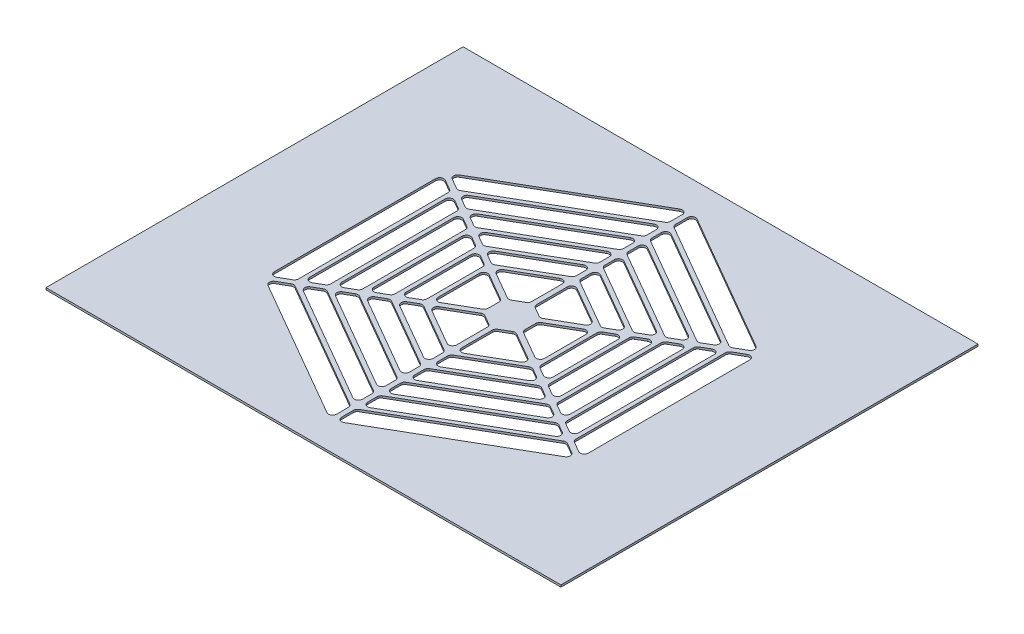
from build123d import *

# Parameters (mm, degrees)
SKETCH_1_W             = 252.630757478
SKETCH_1_H             = 204.6405437
SM_BASE_FLANGE_1_DEPTH = 1
MACRO_START            = -1
MACRO_FEATURE_3_DEPTH  = 1


# Read off the part's stored shape, not the designer's step: 通风口3
# Sheet-metal steps are written as plain solids
with BuildPart() as part:
    # Sketch 1 → 基体-法兰1 (new body)
    with BuildSketch(Plane(origin=(0, 0, 0), x_dir=(1, 0, 0), z_dir=(0, 1, 0))):
        Rectangle(SKETCH_1_W, SKETCH_1_H)
    extrude(amount=-SM_BASE_FLANGE_1_DEPTH)

    # Macro Feature 3 outline → Macro Feature 3 (cut)
    with BuildSketch(Plane(origin=(0, 0, 0), x_dir=(1, 0, 0), z_dir=(0, 1, 0)).offset(MACRO_START)):
        with BuildLine():
            Line((-74.051402444, -41.310221462), (-69.051402444, -38.423470116))
            ThreePointArc((-69.051402444, -38.423470116), (-68.319351637, -37.691419308), (-68.051402444, -36.691419308))
            Line((-68.051402444, -36.691419308), (-68.051402444, 36.691419308))
            ThreePointArc((-68.051402444, 36.691419308), (-68.319351637, 37.691419308), (-69.051402444, 38.423470116))
            Line((-69.051402444, 38.423470116), (-74.051402444, 41.310221462))
            ThreePointArc((-74.051402444, 41.310221462), (-76.051402444, 41.310221462), (-77.051402444, 39.578170654))
            Line((-77.051402444, 39.578170654), (-77.051402444, -39.578170654))
            ThreePointArc((-77.051402444, -39.578170654), (-76.051402444, -41.310221462), (-74.051402444, -41.310221462))
        make_face()
        with BuildLine():
            Line((67.801402444, 40.588533626), (72.801402444, 43.475284971))
            ThreePointArc((72.801402444, 43.475284971), (73.801402444, 45.207335779), (72.801402444, 46.939386587))
            Line((72.801402444, 46.939386587), (4.25, 86.517557241))
            ThreePointArc((4.25, 86.517557241), (2.25, 86.517557241), (1.25, 84.785506433))
            Line((1.25, 84.785506433), (1.25, 79.012003742))
            ThreePointArc((1.25, 79.012003742), (1.517949192, 78.012003742), (2.25, 77.279952934))
            Line((2.25, 77.279952934), (65.801402444, 40.588533626))
            ThreePointArc((65.801402444, 40.588533626), (66.801402444, 40.320584433), (67.801402444, 40.588533626))
        make_face()
        with BuildLine():
            Line((27.801402444, 17.494522858), (31.801402444, 19.803923935))
            ThreePointArc((31.801402444, 19.803923935), (32.801402444, 21.535974742), (31.801402444, 23.26802555))
            Line((31.801402444, 23.26802555), (4.25, 39.174835167))
            ThreePointArc((4.25, 39.174835167), (2.25, 39.174835167), (1.25, 37.44278436))
            Line((1.25, 37.44278436), (1.25, 32.823982206))
            ThreePointArc((1.25, 32.823982206), (1.517949192, 31.823982206), (2.25, 31.091931399))
            Line((2.25, 31.091931399), (25.801402444, 17.494522858))
            ThreePointArc((25.801402444, 17.494522858), (26.801402444, 17.226573665), (27.801402444, 17.494522858))
        make_face()
        with BuildLine():
            Line((-33.051402444, -17.638860425), (-29.051402444, -15.329459348))
            ThreePointArc((-29.051402444, -15.329459348), (-28.319351637, -14.597408541), (-28.051402444, -13.597408541))
            Line((-28.051402444, -13.597408541), (-28.051402444, 13.597408541))
            ThreePointArc((-28.051402444, 13.597408541), (-28.319351637, 14.597408541), (-29.051402444, 15.329459348))
            Line((-29.051402444, 15.329459348), (-33.051402444, 17.638860425))
            ThreePointArc((-33.051402444, 17.638860425), (-35.051402444, 17.638860425), (-36.051402444, 15.906809618))
            Line((-36.051402444, 15.906809618), (-36.051402444, -15.906809618))
            ThreePointArc((-36.051402444, -15.906809618), (-35.051402444, -17.638860425), (-33.051402444, -17.638860425))
        make_face()
        with BuildLine():
            Line((37.801402444, 23.26802555), (41.801402444, 25.577426627))
            ThreePointArc((41.801402444, 25.577426627), (42.801402444, 27.309477434), (41.801402444, 29.041528242))
            Line((41.801402444, 29.041528242), (4.25, 50.721840551))
            ThreePointArc((4.25, 50.721840551), (2.25, 50.721840551), (1.25, 48.989789744))
            Line((1.25, 48.989789744), (1.25, 44.37098759))
            ThreePointArc((1.25, 44.37098759), (1.517949192, 43.37098759), (2.25, 42.638936783))
            Line((2.25, 42.638936783), (35.801402444, 23.26802555))
            ThreePointArc((35.801402444, 23.26802555), (36.801402444, 23.000076357), (37.801402444, 23.26802555))
        make_face()
        with BuildLine():
            Line((-43.051402444, -23.412363117), (-39.051402444, -21.10296204))
            ThreePointArc((-39.051402444, -21.10296204), (-38.319351637, -20.370911233), (-38.051402444, -19.370911233))
            Line((-38.051402444, -19.370911233), (-38.051402444, 19.370911233))
            ThreePointArc((-38.051402444, 19.370911233), (-38.319351637, 20.370911233), (-39.051402444, 21.10296204))
            Line((-39.051402444, 21.10296204), (-43.051402444, 23.412363117))
            ThreePointArc((-43.051402444, 23.412363117), (-45.051402444, 23.412363117), (-46.051402444, 21.68031231))
            Line((-46.051402444, 21.68031231), (-46.051402444, -21.68031231))
            ThreePointArc((-46.051402444, -21.68031231), (-45.051402444, -23.412363117), (-43.051402444, -23.412363117))
        make_face()
        with BuildLine():
            Line((47.801402444, 29.041528242), (51.801402444, 31.350929318))
            ThreePointArc((51.801402444, 31.350929318), (52.801402444, 33.082980126), (51.801402444, 34.815030934))
            Line((51.801402444, 34.815030934), (4.25, 62.268845935))
            ThreePointArc((4.25, 62.268845935), (2.25, 62.268845935), (1.25, 60.536795127))
            Line((1.25, 60.536795127), (1.25, 55.917992974))
            ThreePointArc((1.25, 55.917992974), (1.517949192, 54.917992974), (2.25, 54.185942166))
            Line((2.25, 54.185942166), (45.801402444, 29.041528242))
            ThreePointArc((45.801402444, 29.041528242), (46.801402444, 28.773579049), (47.801402444, 29.041528242))
        make_face()
        with BuildLine():
            Line((57.801402444, 34.815030934), (61.801402444, 37.12443201))
            ThreePointArc((61.801402444, 37.12443201), (62.801402444, 38.856482818), (61.801402444, 40.588533626))
            Line((61.801402444, 40.588533626), (4.25, 73.815851319))
            ThreePointArc((4.25, 73.815851319), (2.25, 73.815851319), (1.25, 72.083800511))
            Line((1.25, 72.083800511), (1.25, 67.464998358))
            ThreePointArc((1.25, 67.464998358), (1.517949192, 66.464998358), (2.25, 65.73294755))
            Line((2.25, 65.73294755), (55.801402444, 34.815030934))
            ThreePointArc((55.801402444, 34.815030934), (56.801402444, 34.547081741), (57.801402444, 34.815030934))
        make_face()
        with BuildLine():
            Line((-53.051402444, -29.185865809), (-49.051402444, -26.876464732))
            ThreePointArc((-49.051402444, -26.876464732), (-48.319351637, -26.144413925), (-48.051402444, -25.144413925))
            Line((-48.051402444, -25.144413925), (-48.051402444, 25.144413925))
            ThreePointArc((-48.051402444, 25.144413925), (-48.319351637, 26.144413925), (-49.051402444, 26.876464732))
            Line((-49.051402444, 26.876464732), (-53.051402444, 29.185865809))
            ThreePointArc((-53.051402444, 29.185865809), (-55.051402444, 29.185865809), (-56.051402444, 27.453815001))
            Line((-56.051402444, 27.453815001), (-56.051402444, -27.453815001))
            ThreePointArc((-56.051402444, -27.453815001), (-55.051402444, -29.185865809), (-53.051402444, -29.185865809))
        make_face()
        with BuildLine():
            Line((-63.051402444, -34.959368501), (-59.051402444, -32.649967424))
            ThreePointArc((-59.051402444, -32.649967424), (-58.319351637, -31.917916617), (-58.051402444, -30.917916617))
            Line((-58.051402444, -30.917916617), (-58.051402444, 30.917916617))
            ThreePointArc((-58.051402444, 30.917916617), (-58.319351637, 31.917916617), (-59.051402444, 32.649967424))
            Line((-59.051402444, 32.649967424), (-63.051402444, 34.959368501))
            ThreePointArc((-63.051402444, 34.959368501), (-65.051402444, 34.959368501), (-66.051402444, 33.227317693))
            Line((-66.051402444, 33.227317693), (-66.051402444, -33.227317693))
            ThreePointArc((-66.051402444, -33.227317693), (-65.051402444, -34.959368501), (-63.051402444, -34.959368501))
        make_face()
        with BuildLine():
            Line((8.801402444, 6.524867743), (21.801402444, 14.030421243))
            ThreePointArc((21.801402444, 14.030421243), (22.801402444, 15.76247205), (21.801402444, 17.494522858))
            Line((21.801402444, 17.494522858), (4.25, 27.627829784))
            ThreePointArc((4.25, 27.627829784), (2.25, 27.627829784), (1.25, 25.895778976))
            Line((1.25, 25.895778976), (1.25, 10.884671977))
            ThreePointArc((1.25, 10.884671977), (1.517949192, 9.884671977), (2.25, 9.15262117))
            Line((2.25, 9.15262117), (6.801402444, 6.524867743))
            ThreePointArc((6.801402444, 6.524867743), (7.801402444, 6.256918551), (8.801402444, 6.524867743))
        make_face()
        with BuildLine():
            Line((-23.051402444, -11.865357733), (-10.051402444, -4.359804234))
            ThreePointArc((-10.051402444, -4.359804234), (-9.319351637, -3.627753426), (-9.051402444, -2.627753426))
            Line((-9.051402444, -2.627753426), (-9.051402444, 2.627753426))
            ThreePointArc((-9.051402444, 2.627753426), (-9.319351637, 3.627753426), (-10.051402444, 4.359804234))
            Line((-10.051402444, 4.359804234), (-23.051402444, 11.865357733))
            ThreePointArc((-23.051402444, 11.865357733), (-25.051402444, 11.865357733), (-26.051402444, 10.133306926))
            Line((-26.051402444, 10.133306926), (-26.051402444, -10.133306926))
            ThreePointArc((-26.051402444, -10.133306926), (-25.051402444, -11.865357733), (-23.051402444, -11.865357733))
        make_face()
        with BuildLine():
            Line((72.801402444, -43.475284971), (67.801402444, -40.588533626))
            ThreePointArc((67.801402444, -40.588533626), (66.801402444, -40.320584433), (65.801402444, -40.588533626))
            Line((65.801402444, -40.588533626), (2.25, -77.279952934))
            ThreePointArc((2.25, -77.279952934), (1.517949192, -78.012003742), (1.25, -79.012003742))
            Line((1.25, -79.012003742), (1.25, -84.785506433))
            ThreePointArc((1.25, -84.785506433), (2.25, -86.517557241), (4.25, -86.517557241))
            Line((4.25, -86.517557241), (72.801402444, -46.939386587))
            ThreePointArc((72.801402444, -46.939386587), (73.801402444, -45.207335779), (72.801402444, -43.475284971))
        make_face()
        with BuildLine():
            Line((61.801402444, -37.12443201), (57.801402444, -34.815030934))
            ThreePointArc((57.801402444, -34.815030934), (56.801402444, -34.547081741), (55.801402444, -34.815030934))
            Line((55.801402444, -34.815030934), (2.25, -65.73294755))
            ThreePointArc((2.25, -65.73294755), (1.517949192, -66.464998358), (1.25, -67.464998358))
            Line((1.25, -67.464998358), (1.25, -72.083800511))
            ThreePointArc((1.25, -72.083800511), (2.25, -73.815851319), (4.25, -73.815851319))
            Line((4.25, -73.815851319), (61.801402444, -40.588533626))
            ThreePointArc((61.801402444, -40.588533626), (62.801402444, -38.856482818), (61.801402444, -37.12443201))
        make_face()
        with BuildLine():
            Line((51.801402444, -31.350929318), (47.801402444, -29.041528242))
            ThreePointArc((47.801402444, -29.041528242), (46.801402444, -28.773579049), (45.801402444, -29.041528242))
            Line((45.801402444, -29.041528242), (2.25, -54.185942166))
            ThreePointArc((2.25, -54.185942166), (1.517949192, -54.917992974), (1.25, -55.917992974))
            Line((1.25, -55.917992974), (1.25, -60.536795127))
            ThreePointArc((1.25, -60.536795127), (2.25, -62.268845935), (4.25, -62.268845935))
            Line((4.25, -62.268845935), (51.801402444, -34.815030934))
            ThreePointArc((51.801402444, -34.815030934), (52.801402444, -33.082980126), (51.801402444, -31.350929318))
        make_face()
        with BuildLine():
            Line((41.801402444, -25.577426627), (37.801402444, -23.26802555))
            ThreePointArc((37.801402444, -23.26802555), (36.801402444, -23.000076357), (35.801402444, -23.26802555))
            Line((35.801402444, -23.26802555), (2.25, -42.638936783))
            ThreePointArc((2.25, -42.638936783), (1.517949192, -43.37098759), (1.25, -44.37098759))
            Line((1.25, -44.37098759), (1.25, -48.989789744))
            ThreePointArc((1.25, -48.989789744), (2.25, -50.721840551), (4.25, -50.721840551))
            Line((4.25, -50.721840551), (41.801402444, -29.041528242))
            ThreePointArc((41.801402444, -29.041528242), (42.801402444, -27.309477434), (41.801402444, -25.577426627))
        make_face()
        with BuildLine():
            Line((31.801402444, -19.803923935), (27.801402444, -17.494522858))
            ThreePointArc((27.801402444, -17.494522858), (26.801402444, -17.226573665), (25.801402444, -17.494522858))
            Line((25.801402444, -17.494522858), (2.25, -31.091931399))
            ThreePointArc((2.25, -31.091931399), (1.517949192, -31.823982206), (1.25, -32.823982206))
            Line((1.25, -32.823982206), (1.25, -37.44278436))
            ThreePointArc((1.25, -37.44278436), (2.25, -39.174835167), (4.25, -39.174835167))
            Line((4.25, -39.174835167), (31.801402444, -23.26802555))
            ThreePointArc((31.801402444, -23.26802555), (32.801402444, -21.535974742), (31.801402444, -19.803923935))
        make_face()
        with BuildLine():
            Line((21.801402444, -14.030421243), (8.801402444, -6.524867743))
            ThreePointArc((8.801402444, -6.524867743), (7.801402444, -6.256918551), (6.801402444, -6.524867743))
            Line((6.801402444, -6.524867743), (2.25, -9.15262117))
            ThreePointArc((2.25, -9.15262117), (1.517949192, -9.884671977), (1.25, -10.884671977))
            Line((1.25, -10.884671977), (1.25, -25.895778976))
            ThreePointArc((1.25, -25.895778976), (2.25, -27.627829784), (4.25, -27.627829784))
            Line((4.25, -27.627829784), (21.801402444, -17.494522858))
            ThreePointArc((21.801402444, -17.494522858), (22.801402444, -15.76247205), (21.801402444, -14.030421243))
        make_face()
        with BuildLine():
            Line((-1.25, 79.012003742), (-1.25, 84.785506433))
            ThreePointArc((-1.25, 84.785506433), (-2.25, 86.517557241), (-4.25, 86.517557241))
            Line((-4.25, 86.517557241), (-72.801402444, 46.939386587))
            ThreePointArc((-72.801402444, 46.939386587), (-73.801402444, 45.207335779), (-72.801402444, 43.475284971))
            Line((-72.801402444, 43.475284971), (-67.801402444, 40.588533626))
            ThreePointArc((-67.801402444, 40.588533626), (-66.801402444, 40.320584433), (-65.801402444, 40.588533626))
            Line((-65.801402444, 40.588533626), (-2.25, 77.279952934))
            ThreePointArc((-2.25, 77.279952934), (-1.517949192, 78.012003742), (-1.25, 79.012003742))
        make_face()
        with BuildLine():
            Line((-1.25, -84.785506433), (-1.25, -79.012003742))
            ThreePointArc((-1.25, -79.012003742), (-1.517949192, -78.012003742), (-2.25, -77.279952934))
            Line((-2.25, -77.279952934), (-65.801402444, -40.588533626))
            ThreePointArc((-65.801402444, -40.588533626), (-66.801402444, -40.320584433), (-67.801402444, -40.588533626))
            Line((-67.801402444, -40.588533626), (-72.801402444, -43.475284971))
            ThreePointArc((-72.801402444, -43.475284971), (-73.801402444, -45.207335779), (-72.801402444, -46.939386587))
            Line((-72.801402444, -46.939386587), (-4.25, -86.517557241))
            ThreePointArc((-4.25, -86.517557241), (-2.25, -86.517557241), (-1.25, -84.785506433))
        make_face()
        with BuildLine():
            Line((-1.25, -72.083800511), (-1.25, -67.464998358))
            ThreePointArc((-1.25, -67.464998358), (-1.517949192, -66.464998358), (-2.25, -65.73294755))
            Line((-2.25, -65.73294755), (-55.801402444, -34.815030934))
            ThreePointArc((-55.801402444, -34.815030934), (-56.801402444, -34.547081741), (-57.801402444, -34.815030934))
            Line((-57.801402444, -34.815030934), (-61.801402444, -37.12443201))
            ThreePointArc((-61.801402444, -37.12443201), (-62.801402444, -38.856482818), (-61.801402444, -40.588533626))
            Line((-61.801402444, -40.588533626), (-4.25, -73.815851319))
            ThreePointArc((-4.25, -73.815851319), (-2.25, -73.815851319), (-1.25, -72.083800511))
        make_face()
        with BuildLine():
            Line((-1.25, -60.536795127), (-1.25, -55.917992974))
            ThreePointArc((-1.25, -55.917992974), (-1.517949192, -54.917992974), (-2.25, -54.185942166))
            Line((-2.25, -54.185942166), (-45.801402444, -29.041528242))
            ThreePointArc((-45.801402444, -29.041528242), (-46.801402444, -28.773579049), (-47.801402444, -29.041528242))
            Line((-47.801402444, -29.041528242), (-51.801402444, -31.350929318))
            ThreePointArc((-51.801402444, -31.350929318), (-52.801402444, -33.082980126), (-51.801402444, -34.815030934))
            Line((-51.801402444, -34.815030934), (-4.25, -62.268845935))
            ThreePointArc((-4.25, -62.268845935), (-2.25, -62.268845935), (-1.25, -60.536795127))
        make_face()
        with BuildLine():
            Line((-1.25, -48.989789744), (-1.25, -44.37098759))
            ThreePointArc((-1.25, -44.37098759), (-1.517949192, -43.37098759), (-2.25, -42.638936783))
            Line((-2.25, -42.638936783), (-35.801402444, -23.26802555))
            ThreePointArc((-35.801402444, -23.26802555), (-36.801402444, -23.000076357), (-37.801402444, -23.26802555))
            Line((-37.801402444, -23.26802555), (-41.801402444, -25.577426627))
            ThreePointArc((-41.801402444, -25.577426627), (-42.801402444, -27.309477434), (-41.801402444, -29.041528242))
            Line((-41.801402444, -29.041528242), (-4.25, -50.721840551))
            ThreePointArc((-4.25, -50.721840551), (-2.25, -50.721840551), (-1.25, -48.989789744))
        make_face()
        with BuildLine():
            Line((-1.25, -37.44278436), (-1.25, -32.823982206))
            ThreePointArc((-1.25, -32.823982206), (-1.517949192, -31.823982206), (-2.25, -31.091931399))
            Line((-2.25, -31.091931399), (-25.801402444, -17.494522858))
            ThreePointArc((-25.801402444, -17.494522858), (-26.801402444, -17.226573665), (-27.801402444, -17.494522858))
            Line((-27.801402444, -17.494522858), (-31.801402444, -19.803923935))
            ThreePointArc((-31.801402444, -19.803923935), (-32.801402444, -21.535974742), (-31.801402444, -23.26802555))
            Line((-31.801402444, -23.26802555), (-4.25, -39.174835167))
            ThreePointArc((-4.25, -39.174835167), (-2.25, -39.174835167), (-1.25, -37.44278436))
        make_face()
        with BuildLine():
            Line((-1.25, 32.823982206), (-1.25, 37.44278436))
            ThreePointArc((-1.25, 37.44278436), (-2.25, 39.174835167), (-4.25, 39.174835167))
            Line((-4.25, 39.174835167), (-31.801402444, 23.26802555))
            ThreePointArc((-31.801402444, 23.26802555), (-32.801402444, 21.535974742), (-31.801402444, 19.803923935))
            Line((-31.801402444, 19.803923935), (-27.801402444, 17.494522858))
            ThreePointArc((-27.801402444, 17.494522858), (-26.801402444, 17.226573665), (-25.801402444, 17.494522858))
            Line((-25.801402444, 17.494522858), (-2.25, 31.091931399))
            ThreePointArc((-2.25, 31.091931399), (-1.517949192, 31.823982206), (-1.25, 32.823982206))
        make_face()
        with BuildLine():
            Line((-1.25, 44.37098759), (-1.25, 48.989789744))
            ThreePointArc((-1.25, 48.989789744), (-2.25, 50.721840551), (-4.25, 50.721840551))
            Line((-4.25, 50.721840551), (-41.801402444, 29.041528242))
            ThreePointArc((-41.801402444, 29.041528242), (-42.801402444, 27.309477434), (-41.801402444, 25.577426627))
            Line((-41.801402444, 25.577426627), (-37.801402444, 23.26802555))
            ThreePointArc((-37.801402444, 23.26802555), (-36.801402444, 23.000076357), (-35.801402444, 23.26802555))
            Line((-35.801402444, 23.26802555), (-2.25, 42.638936783))
            ThreePointArc((-2.25, 42.638936783), (-1.517949192, 43.37098759), (-1.25, 44.37098759))
        make_face()
        with BuildLine():
            Line((-1.25, 55.917992974), (-1.25, 60.536795127))
            ThreePointArc((-1.25, 60.536795127), (-2.25, 62.268845935), (-4.25, 62.268845935))
            Line((-4.25, 62.268845935), (-51.801402444, 34.815030934))
            ThreePointArc((-51.801402444, 34.815030934), (-52.801402444, 33.082980126), (-51.801402444, 31.350929318))
            Line((-51.801402444, 31.350929318), (-47.801402444, 29.041528242))
            ThreePointArc((-47.801402444, 29.041528242), (-46.801402444, 28.773579049), (-45.801402444, 29.041528242))
            Line((-45.801402444, 29.041528242), (-2.25, 54.185942166))
            ThreePointArc((-2.25, 54.185942166), (-1.517949192, 54.917992974), (-1.25, 55.917992974))
        make_face()
        with BuildLine():
            Line((-1.25, 67.464998358), (-1.25, 72.083800511))
            ThreePointArc((-1.25, 72.083800511), (-2.25, 73.815851319), (-4.25, 73.815851319))
            Line((-4.25, 73.815851319), (-61.801402444, 40.588533626))
            ThreePointArc((-61.801402444, 40.588533626), (-62.801402444, 38.856482818), (-61.801402444, 37.12443201))
            Line((-61.801402444, 37.12443201), (-57.801402444, 34.815030934))
            ThreePointArc((-57.801402444, 34.815030934), (-56.801402444, 34.547081741), (-55.801402444, 34.815030934))
            Line((-55.801402444, 34.815030934), (-2.25, 65.73294755))
            ThreePointArc((-2.25, 65.73294755), (-1.517949192, 66.464998358), (-1.25, 67.464998358))
        make_face()
        with BuildLine():
            Line((-1.25, -25.895778976), (-1.25, -10.884671977))
            ThreePointArc((-1.25, -10.884671977), (-1.517949192, -9.884671977), (-2.25, -9.15262117))
            Line((-2.25, -9.15262117), (-6.801402444, -6.524867743))
            ThreePointArc((-6.801402444, -6.524867743), (-7.801402444, -6.256918551), (-8.801402444, -6.524867743))
            Line((-8.801402444, -6.524867743), (-21.801402444, -14.030421243))
            ThreePointArc((-21.801402444, -14.030421243), (-22.801402444, -15.76247205), (-21.801402444, -17.494522858))
            Line((-21.801402444, -17.494522858), (-4.25, -27.627829784))
            ThreePointArc((-4.25, -27.627829784), (-2.25, -27.627829784), (-1.25, -25.895778976))
        make_face()
        with BuildLine():
            Line((-1.25, 10.884671977), (-1.25, 25.895778976))
            ThreePointArc((-1.25, 25.895778976), (-2.25, 27.627829784), (-4.25, 27.627829784))
            Line((-4.25, 27.627829784), (-21.801402444, 17.494522858))
            ThreePointArc((-21.801402444, 17.494522858), (-22.801402444, 15.76247205), (-21.801402444, 14.030421243))
            Line((-21.801402444, 14.030421243), (-8.801402444, 6.524867743))
            ThreePointArc((-8.801402444, 6.524867743), (-7.801402444, 6.256918551), (-6.801402444, 6.524867743))
            Line((-6.801402444, 6.524867743), (-2.25, 9.15262117))
            ThreePointArc((-2.25, 9.15262117), (-1.517949192, 9.884671977), (-1.25, 10.884671977))
        make_face()
        with BuildLine():
            Line((69.051402444, -38.423470116), (74.051402444, -41.310221462))
            ThreePointArc((74.051402444, -41.310221462), (76.051402444, -41.310221462), (77.051402444, -39.578170654))
            Line((77.051402444, -39.578170654), (77.051402444, 39.578170654))
            ThreePointArc((77.051402444, 39.578170654), (76.051402444, 41.310221462), (74.051402444, 41.310221462))
            Line((74.051402444, 41.310221462), (69.051402444, 38.423470116))
            ThreePointArc((69.051402444, 38.423470116), (68.319351637, 37.691419308), (68.051402444, 36.691419308))
            Line((68.051402444, 36.691419308), (68.051402444, -36.691419308))
            ThreePointArc((68.051402444, -36.691419308), (68.319351637, -37.691419308), (69.051402444, -38.423470116))
        make_face()
        with BuildLine():
            Line((29.051402444, -15.329459348), (33.051402444, -17.638860425))
            ThreePointArc((33.051402444, -17.638860425), (35.051402444, -17.638860425), (36.051402444, -15.906809618))
            Line((36.051402444, -15.906809618), (36.051402444, 15.906809618))
            ThreePointArc((36.051402444, 15.906809618), (35.051402444, 17.638860425), (33.051402444, 17.638860425))
            Line((33.051402444, 17.638860425), (29.051402444, 15.329459348))
            ThreePointArc((29.051402444, 15.329459348), (28.319351637, 14.597408541), (28.051402444, 13.597408541))
            Line((28.051402444, 13.597408541), (28.051402444, -13.597408541))
            ThreePointArc((28.051402444, -13.597408541), (28.319351637, -14.597408541), (29.051402444, -15.329459348))
        make_face()
        with BuildLine():
            Line((39.051402444, -21.10296204), (43.051402444, -23.412363117))
            ThreePointArc((43.051402444, -23.412363117), (45.051402444, -23.412363117), (46.051402444, -21.68031231))
            Line((46.051402444, -21.68031231), (46.051402444, 21.68031231))
            ThreePointArc((46.051402444, 21.68031231), (45.051402444, 23.412363117), (43.051402444, 23.412363117))
            Line((43.051402444, 23.412363117), (39.051402444, 21.10296204))
            ThreePointArc((39.051402444, 21.10296204), (38.319351637, 20.370911233), (38.051402444, 19.370911233))
            Line((38.051402444, 19.370911233), (38.051402444, -19.370911233))
            ThreePointArc((38.051402444, -19.370911233), (38.319351637, -20.370911233), (39.051402444, -21.10296204))
        make_face()
        with BuildLine():
            Line((59.051402444, -32.649967424), (63.051402444, -34.959368501))
            ThreePointArc((63.051402444, -34.959368501), (65.051402444, -34.959368501), (66.051402444, -33.227317693))
            Line((66.051402444, -33.227317693), (66.051402444, 33.227317693))
            ThreePointArc((66.051402444, 33.227317693), (65.051402444, 34.959368501), (63.051402444, 34.959368501))
            Line((63.051402444, 34.959368501), (59.051402444, 32.649967424))
            ThreePointArc((59.051402444, 32.649967424), (58.319351637, 31.917916617), (58.051402444, 30.917916617))
            Line((58.051402444, 30.917916617), (58.051402444, -30.917916617))
            ThreePointArc((58.051402444, -30.917916617), (58.319351637, -31.917916617), (59.051402444, -32.649967424))
        make_face()
        with BuildLine():
            Line((49.051402444, -26.876464732), (53.051402444, -29.185865809))
            ThreePointArc((53.051402444, -29.185865809), (55.051402444, -29.185865809), (56.051402444, -27.453815001))
            Line((56.051402444, -27.453815001), (56.051402444, 27.453815001))
            ThreePointArc((56.051402444, 27.453815001), (55.051402444, 29.185865809), (53.051402444, 29.185865809))
            Line((53.051402444, 29.185865809), (49.051402444, 26.876464732))
            ThreePointArc((49.051402444, 26.876464732), (48.319351637, 26.144413925), (48.051402444, 25.144413925))
            Line((48.051402444, 25.144413925), (48.051402444, -25.144413925))
            ThreePointArc((48.051402444, -25.144413925), (48.319351637, -26.144413925), (49.051402444, -26.876464732))
        make_face()
        with BuildLine():
            Line((10.051402444, -4.359804234), (23.051402444, -11.865357733))
            ThreePointArc((23.051402444, -11.865357733), (25.051402444, -11.865357733), (26.051402444, -10.133306926))
            Line((26.051402444, -10.133306926), (26.051402444, 10.133306926))
            ThreePointArc((26.051402444, 10.133306926), (25.051402444, 11.865357733), (23.051402444, 11.865357733))
            Line((23.051402444, 11.865357733), (10.051402444, 4.359804234))
            ThreePointArc((10.051402444, 4.359804234), (9.319351637, 3.627753426), (9.051402444, 2.627753426))
            Line((9.051402444, 2.627753426), (9.051402444, -2.627753426))
            ThreePointArc((9.051402444, -2.627753426), (9.319351637, -3.627753426), (10.051402444, -4.359804234))
        make_face()
    extrude(amount=MACRO_FEATURE_3_DEPTH, mode=Mode.SUBTRACT)


solid = part.part
